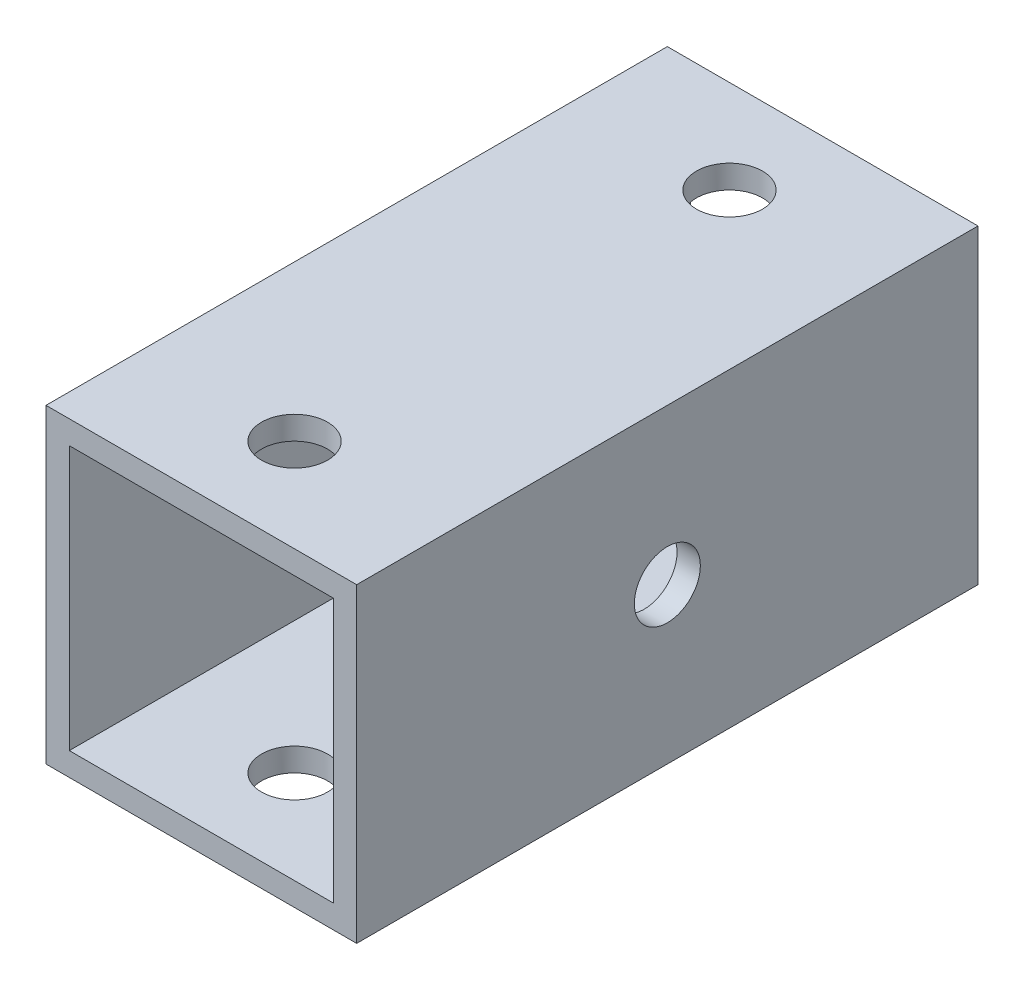
from build123d import *

# Parameters (mm, degrees)
SKETCH1_W           = 20
SKETCH1_H           = 20
SKETCH1_W_2         = 17
SKETCH1_H_2         = 17
BOSS_EXTRUDE1_DEPTH = 40
SKETCH2_R           = 2.125
CUT_EXTRUDE1_DEPTH  = 46.82575695
SKETCH3_R           = 2.125
CUT_EXTRUDE2_DEPTH  = 46.82575695


with BuildPart() as part:
    # Sketch1 → Boss-Extrude1 (new body)
    with BuildSketch(Plane.XY):
        Rectangle(SKETCH1_W, SKETCH1_H)
        Rectangle(SKETCH1_W_2, SKETCH1_H_2, mode=Mode.SUBTRACT)
    extrude(amount=-BOSS_EXTRUDE1_DEPTH)

    # Sketch2 → Cut-Extrude1 (cut, through all)
    with BuildSketch(Plane(origin=(0, 10, 0), x_dir=(1, 0, 0), z_dir=(0, 1, 0))):
        with Locations((0, 6)):
            Circle(SKETCH2_R)
        with Locations((0, 34)):
            Circle(SKETCH2_R)
    extrude(amount=-CUT_EXTRUDE1_DEPTH, mode=Mode.SUBTRACT)

    # Sketch3 → Cut-Extrude2 (cut, through all)
    with BuildSketch(Plane(origin=(10, 0, 0), x_dir=(0, 0, -1), z_dir=(1, 0, 0))):
        with Locations((20, 0)):
            Circle(SKETCH3_R)
    extrude(amount=-CUT_EXTRUDE2_DEPTH, mode=Mode.SUBTRACT)


solid = part.part
